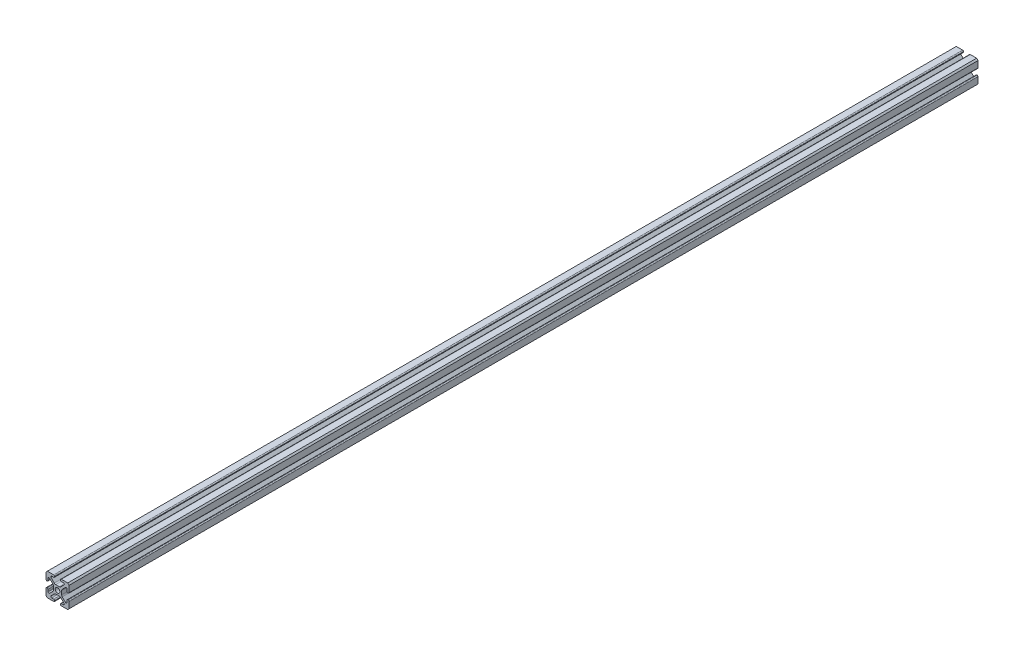
from build123d import *

# Parameters (mm, degrees)
BOSS_EXTRUDE1_DEPTH = 1000.21


with BuildPart() as part:
    # Sketch1 → Boss-Extrude1 (new body)
    with BuildSketch(Plane.XY):
        with BuildLine():
            Line((-11.199951579, -12.7), (-4.222256762, -12.7))
            ThreePointArc((-4.222256762, -12.7), (-3.503836272, -12.40242049), (-3.206256762, -11.684))
            Line((-3.206256762, -11.684), (-3.206256762, -11.440665395))
            ThreePointArc((-3.206256762, -11.440665395), (-3.503836272, -10.722244905), (-4.222256762, -10.424665395))
            Line((-4.222256762, -10.424665395), (-6.40926672, -10.424665395))
            ThreePointArc((-6.40926672, -10.424665395), (-7.347928334, -9.797471742), (-7.127687178, -8.690244874))
            Line((-7.127687178, -8.690244874), (-3.593166694, -5.155724698))
            ThreePointArc((-3.593166694, -5.155724698), (-2.876257435, -4.67670128), (-2.030605322, -4.508490626))
            Line((-2.030605322, -4.508490626), (2.030598864, -4.508490626))
            ThreePointArc((2.030598864, -4.508490626), (2.876251031, -4.676701303), (3.593160319, -5.155724782))
            Line((3.593160319, -5.155724782), (7.127680379, -8.690244912))
            ThreePointArc((7.127680379, -8.690244912), (7.347921489, -9.019859032), (7.425259882, -9.408665395))
            ThreePointArc((7.425259882, -9.408665395), (7.127680372, -10.127085884), (6.409259882, -10.424665395))
            Line((6.409259882, -10.424665395), (4.22225065, -10.424665395))
            ThreePointArc((4.22225065, -10.424665395), (3.50383016, -10.722244905), (3.20625065, -11.440665395))
            Line((3.20625065, -11.440665395), (3.20625065, -11.684))
            ThreePointArc((3.20625065, -11.684), (3.50383016, -12.40242049), (4.22225065, -12.7))
            Line((4.22225065, -12.7), (11.199952422, -12.7))
            Line((11.199952422, -12.7), (12.7, -11.199951732))
            Line((12.7, -11.199951732), (12.7, -4.222256762))
            ThreePointArc((12.7, -4.222256762), (12.40242049, -3.503836272), (11.684, -3.206256762))
            Line((11.684, -3.206256762), (11.440665395, -3.206256762))
            ThreePointArc((11.440665395, -3.206256762), (10.722244905, -3.503836272), (10.424665395, -4.222256762))
            Line((10.424665395, -4.222256762), (10.424665395, -6.40926672))
            ThreePointArc((10.424665395, -6.40926672), (9.797471742, -7.347928334), (8.690244874, -7.127687178))
            Line((8.690244874, -7.127687178), (5.155724698, -3.593166694))
            ThreePointArc((5.155724698, -3.593166694), (4.67670128, -2.876257435), (4.508490626, -2.030605322))
            Line((4.508490626, -2.030605322), (4.508490626, 2.030598864))
            ThreePointArc((4.508490626, 2.030598864), (4.676701303, 2.876251031), (5.155724782, 3.593160319))
            Line((5.155724782, 3.593160319), (8.690244912, 7.127680379))
            ThreePointArc((8.690244912, 7.127680379), (9.019859032, 7.347921489), (9.408665395, 7.425259882))
            ThreePointArc((9.408665395, 7.425259882), (10.127085884, 7.127680372), (10.424665395, 6.409259882))
            Line((10.424665395, 6.409259882), (10.424665395, 4.22225065))
            ThreePointArc((10.424665395, 4.22225065), (10.722244905, 3.50383016), (11.440665395, 3.20625065))
            Line((11.440665395, 3.20625065), (11.684, 3.20625065))
            ThreePointArc((11.684, 3.20625065), (12.40242049, 3.50383016), (12.7, 4.22225065))
            Line((12.7, 4.22225065), (12.7, 11.199954756))
            Line((12.7, 11.199954756), (11.199954423, 12.7))
            Line((11.199954423, 12.7), (4.222256762, 12.7))
            ThreePointArc((4.222256762, 12.7), (3.503836272, 12.40242049), (3.206256762, 11.684))
            Line((3.206256762, 11.684), (3.206256762, 11.440665395))
            ThreePointArc((3.206256762, 11.440665395), (3.503836272, 10.722244905), (4.222256762, 10.424665395))
            Line((4.222256762, 10.424665395), (6.40926672, 10.424665395))
            ThreePointArc((6.40926672, 10.424665395), (7.347928334, 9.797471742), (7.127687178, 8.690244874))
            Line((7.127687178, 8.690244874), (3.593166694, 5.155724698))
            ThreePointArc((3.593166694, 5.155724698), (2.876257435, 4.67670128), (2.030605322, 4.508490626))
            Line((2.030605322, 4.508490626), (-2.030598864, 4.508490626))
            ThreePointArc((-2.030598864, 4.508490626), (-2.876251031, 4.676701303), (-3.593160319, 5.155724782))
            Line((-3.593160319, 5.155724782), (-7.127680379, 8.690244912))
            ThreePointArc((-7.127680379, 8.690244912), (-7.347921489, 9.019859032), (-7.425259882, 9.408665395))
            ThreePointArc((-7.425259882, 9.408665395), (-7.127680372, 10.127085884), (-6.409259882, 10.424665395))
            Line((-6.409259882, 10.424665395), (-4.22225065, 10.424665395))
            ThreePointArc((-4.22225065, 10.424665395), (-3.50383016, 10.722244905), (-3.20625065, 11.440665395))
            Line((-3.20625065, 11.440665395), (-3.20625065, 11.684))
            ThreePointArc((-3.20625065, 11.684), (-3.50383016, 12.40242049), (-4.22225065, 12.7))
            Line((-4.22225065, 12.7), (-11.199951733, 12.7))
            Line((-11.199951733, 12.7), (-12.7, 11.1999514))
            Line((-12.7, 11.1999514), (-12.7, 4.222256762))
            ThreePointArc((-12.7, 4.222256762), (-12.40242049, 3.503836272), (-11.684, 3.206256762))
            Line((-11.684, 3.206256762), (-11.440665395, 3.206256762))
            ThreePointArc((-11.440665395, 3.206256762), (-10.722244905, 3.503836272), (-10.424665395, 4.222256762))
            Line((-10.424665395, 4.222256762), (-10.424665395, 6.40926672))
            ThreePointArc((-10.424665395, 6.40926672), (-9.797471742, 7.347928334), (-8.690244874, 7.127687178))
            Line((-8.690244874, 7.127687178), (-5.155724698, 3.593166694))
            ThreePointArc((-5.155724698, 3.593166694), (-4.67670128, 2.876257435), (-4.508490626, 2.030605322))
            Line((-4.508490626, 2.030605322), (-4.508490626, -2.030598864))
            ThreePointArc((-4.508490626, -2.030598864), (-4.676701303, -2.876251031), (-5.155724782, -3.593160319))
            Line((-5.155724782, -3.593160319), (-8.690244912, -7.127680379))
            ThreePointArc((-8.690244912, -7.127680379), (-9.019859032, -7.347921489), (-9.408665395, -7.425259882))
            ThreePointArc((-9.408665395, -7.425259882), (-10.127085884, -7.127680372), (-10.424665395, -6.409259882))
            Line((-10.424665395, -6.409259882), (-10.424665395, -4.22225065))
            ThreePointArc((-10.424665395, -4.22225065), (-10.722244905, -3.50383016), (-11.440665395, -3.20625065))
            Line((-11.440665395, -3.20625065), (-11.684, -3.20625065))
            ThreePointArc((-11.684, -3.20625065), (-12.40242049, -3.50383016), (-12.7, -4.22225065))
            Line((-12.7, -4.22225065), (-12.7, -11.199952268))
            Line((-12.7, -11.199952268), (-11.199951579, -12.7))
        make_face()
        with BuildLine():
            ThreePointArc((-2.55499489, 0), (0, -2.55499489), (2.55499489, 0))
            ThreePointArc((2.55499489, 0), (0, 2.55499489), (-2.55499489, 0))
        make_face(mode=Mode.SUBTRACT)
    extrude(amount=BOSS_EXTRUDE1_DEPTH)


solid = part.part
